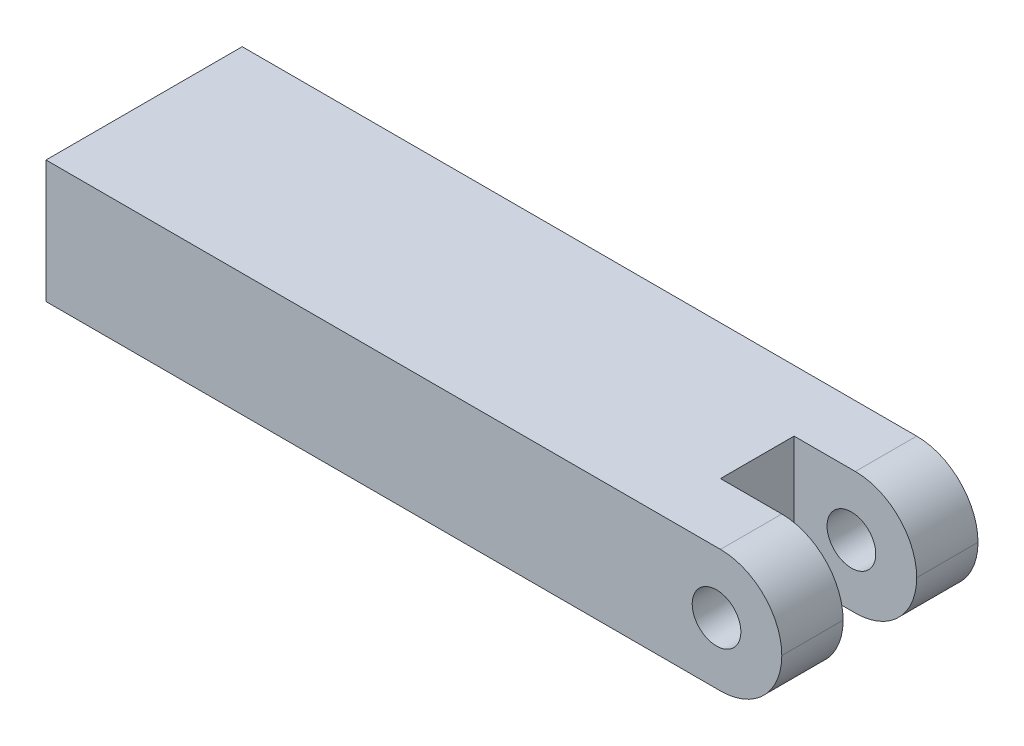
from build123d import *

# Parameters (mm, degrees)
ESQUISSE2_W             = 100
ESQUISSE2_H             = 20
BOSS_EXTRU_1_DEPTH      = 32
ESQUISSE6_W             = 10
ESQUISSE6_H             = 20
BOSS_EXTRU_3_DEPTH      = 20
CONG_2_R                = 10
ESQUISSE7_R             = 3.96875
ENL_V_MAT_EXTRU_1_DEPTH = 78.614431648


with BuildPart() as part:
    # Esquisse2 → Boss.-Extru.1 (new body)
    with BuildSketch(Plane.XY):
        Rectangle(ESQUISSE2_W, ESQUISSE2_H)
    extrude(amount=BOSS_EXTRU_1_DEPTH)

    # Esquisse6 → Boss.-Extru.3 (add)
    with BuildSketch(Plane(origin=(50, 0, 0), x_dir=(0, 0, -1), z_dir=(1, 0, 0))):
        with Locations((-27, 0)):
            Rectangle(ESQUISSE6_W, ESQUISSE6_H)
        with Locations((-5, 0)):
            Rectangle(ESQUISSE6_W, ESQUISSE6_H)
    extrude(amount=BOSS_EXTRU_3_DEPTH)

    # Congé2
    cong_2_edges = [part.edges().sort_by_distance(p)[0] for p in [
        (70, -10, 27),
        (70, -10, 5),
        (70, 10, 5),
        (70, 10, 27),
    ]]
    fillet(cong_2_edges, radius=CONG_2_R - 0.0001)  # a hair under: the kernel refuses the full size

    # Esquisse7 → Enlèv. mat.-Extru.1 (cut, through all)
    with BuildSketch(Plane(origin=(0, 0, 0), x_dir=(-1, 0, 0), z_dir=(0, 0, -1))):
        with Locations((-59.35415424, 0)):
            Circle(ESQUISSE7_R)
    extrude(amount=-ENL_V_MAT_EXTRU_1_DEPTH, mode=Mode.SUBTRACT)


solid = part.part
